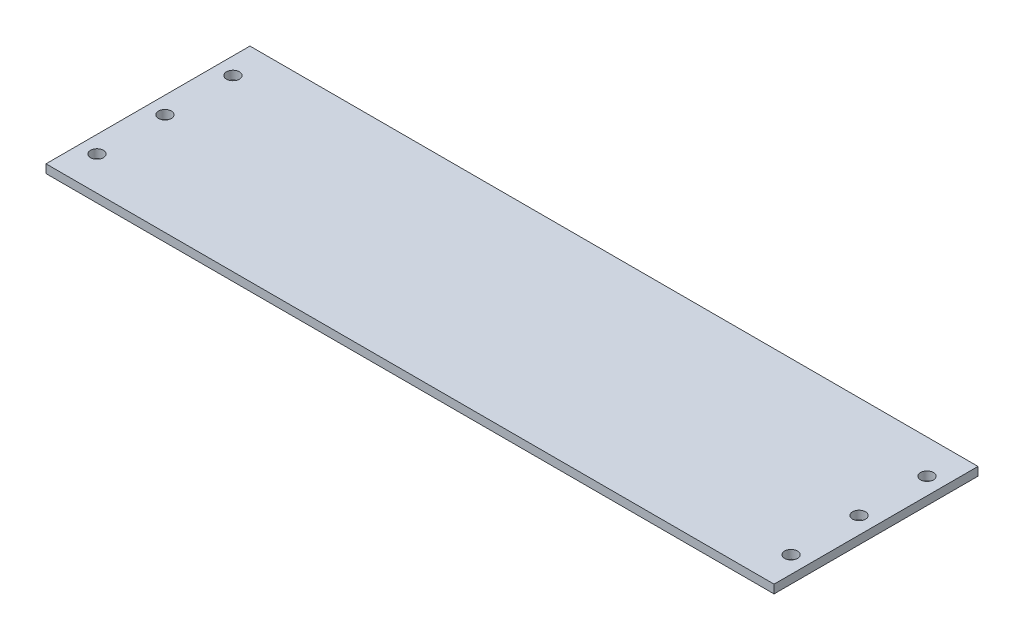
from build123d import *

# Parameters (mm, degrees)
SKETCH1_W           = 272.034
SKETCH1_H           = 76.2
SKETCH1_R           = 2.413
BOSS_EXTRUDE1_DEPTH = 3.175


with BuildPart() as part:
    # Sketch1 → Boss-Extrude1 (new body)
    with BuildSketch(Plane(origin=(0, 0, 0), x_dir=(1, 0, 0), z_dir=(0, 1, 0))):
        with Locations((136.017, 38.1)):
            Rectangle(SKETCH1_W, SKETCH1_H)
        with Locations((6.35, 63.5)):
            Circle(SKETCH1_R, mode=Mode.SUBTRACT)
        with Locations((6.35, 38.1)):
            Circle(SKETCH1_R, mode=Mode.SUBTRACT)
        with Locations((6.35, 12.7)):
            Circle(SKETCH1_R, mode=Mode.SUBTRACT)
        with Locations((265.684, 12.7)):
            Circle(SKETCH1_R, mode=Mode.SUBTRACT)
        with Locations((265.684, 38.1)):
            Circle(SKETCH1_R, mode=Mode.SUBTRACT)
        with Locations((265.684, 63.5)):
            Circle(SKETCH1_R, mode=Mode.SUBTRACT)
    extrude(amount=BOSS_EXTRUDE1_DEPTH)


solid = part.part
